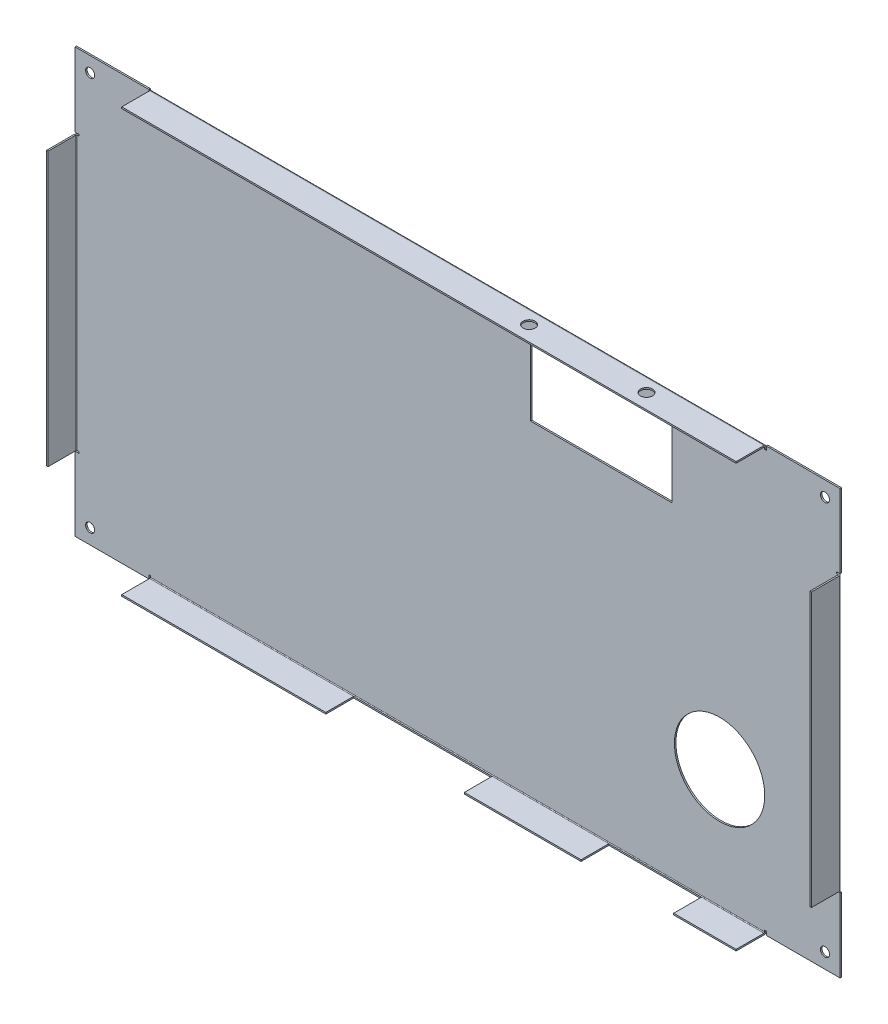
from build123d import *

# Parameters (mm, degrees)
SKETCH_1_W                        = 508
SKETCH_1_H                        = 281.5
SKETCH_1_R                        = 3
SKETCH_1_R_2                      = 30
SKETCH_1_W_2                      = 94
SKETCH_1_H_2                      = 46
SM_BASE_FLANGE_1_DEPTH            = 1
SM_EDGE_FLANGE_1_STRIP_W          = 5
SM_EDGE_FLANGE_1_STRIP_H          = 1
SM_EDGE_FLANGE_1_STRIP_CUT_DEPTH  = 408
SM_EDGE_FLANGE_1_RELIEF_W         = 6
SM_EDGE_FLANGE_1_RELIEF_H         = 1
SM_EDGE_FLANGE_1_RELIEF_CUT_DEPTH = 1
SM_EDGE_FLANGE_1_DEPTH            = 408
SM_EDGE_FLANGE_2_STRIP_W          = 5
SM_EDGE_FLANGE_2_STRIP_H          = 1
SM_EDGE_FLANGE_2_STRIP_CUT_DEPTH  = 408
SM_EDGE_FLANGE_2_RELIEF_W         = 6
SM_EDGE_FLANGE_2_RELIEF_H         = 1
SM_EDGE_FLANGE_2_RELIEF_CUT_DEPTH = 1
SM_EDGE_FLANGE_2_DEPTH            = 408
SM_EDGE_FLANGE_3_STRIP_W          = 5
SM_EDGE_FLANGE_3_STRIP_H          = 1
SM_EDGE_FLANGE_3_STRIP_CUT_DEPTH  = 181.5
SM_EDGE_FLANGE_3_RELIEF_W         = 6
SM_EDGE_FLANGE_3_RELIEF_H         = 1
SM_EDGE_FLANGE_3_RELIEF_CUT_DEPTH = 1
SM_EDGE_FLANGE_3_DEPTH            = 181.5
SM_EDGE_FLANGE_4_STRIP_W          = 5
SM_EDGE_FLANGE_4_STRIP_H          = 1
SM_EDGE_FLANGE_4_STRIP_CUT_DEPTH  = 181.5
SM_EDGE_FLANGE_4_RELIEF_W         = 6
SM_EDGE_FLANGE_4_RELIEF_H         = 1
SM_EDGE_FLANGE_4_RELIEF_CUT_DEPTH = 1
SM_EDGE_FLANGE_4_DEPTH            = 181.5
SKETCH_18_R                       = 4
CUT_EXTRUDE_1_DEPTH               = 379.889495764
SKETCH_19_W                       = 92
SKETCH_19_H                       = 18.5
SKETCH_19_W_2                     = 61.5
CUT_EXTRUDE_2_DEPTH               = 379.889495764


# Sheet-metal steps are written as plain solids
with BuildPart() as part:
    # Sketch 1 → 基体-法兰1 (new body)
    with BuildSketch(Plane.XY):
        Rectangle(SKETCH_1_W, SKETCH_1_H)
        with Locations((-244, 130.75)):
            Circle(SKETCH_1_R, mode=Mode.SUBTRACT)
        with Locations((-244, -130.75)):
            Circle(SKETCH_1_R, mode=Mode.SUBTRACT)
        with Locations((244, 130.75)):
            Circle(SKETCH_1_R, mode=Mode.SUBTRACT)
        with Locations((244, -130.75)):
            Circle(SKETCH_1_R, mode=Mode.SUBTRACT)
        with Locations((174, -60.75)):
            Circle(SKETCH_1_R_2, mode=Mode.SUBTRACT)
        with Locations((95.5, 99.75)):
            Rectangle(SKETCH_1_W_2, SKETCH_1_H_2, mode=Mode.SUBTRACT)
    extrude(amount=-SM_BASE_FLANGE_1_DEPTH)

    # 边线-法兰1 strip (across the edge) → 边线-法兰1 strip cut (cut)
    with BuildSketch(Plane(origin=(204, 140.75, 0), x_dir=(0, -1, 0), z_dir=(-1, 0, 0))):
        with Locations((-1, -0.5)):
            Rectangle(SM_EDGE_FLANGE_1_STRIP_W, SM_EDGE_FLANGE_1_STRIP_H)
    extrude(amount=SM_EDGE_FLANGE_1_STRIP_CUT_DEPTH, mode=Mode.SUBTRACT)

    # 边线-法兰1 relief (on the sheet) → 边线-法兰1 relief cut (cut)
    with BuildSketch(Plane(origin=(204, 139.25, 0), x_dir=(0, -1, 0), z_dir=(0, 0, 1))):
        with Locations((-2, 0.5)):
            Rectangle(SM_EDGE_FLANGE_1_RELIEF_W, SM_EDGE_FLANGE_1_RELIEF_H)
        with Locations((-2, -408.5)):
            Rectangle(SM_EDGE_FLANGE_1_RELIEF_W, SM_EDGE_FLANGE_1_RELIEF_H)
    extrude(amount=-SM_EDGE_FLANGE_1_RELIEF_CUT_DEPTH, mode=Mode.SUBTRACT)

    # 边线-法兰1 section (across the edge) → 边线-法兰1 (add)
    with BuildSketch(Plane(origin=(204, 140.75, 0), x_dir=(0, -1, 0), z_dir=(-1, 0, 0))):
        with BuildLine():
            Line((0, 0.5), (0, 19))
            Line((0, 19), (1, 19))
            Line((1, 19), (1, 0.5))
            ThreePointArc((1, 0.5), (1.146446609, 0.146446609), (1.5, 0))
            Line((1.5, 0), (1.5, -1))
            ThreePointArc((1.5, -1), (0.439339828, -0.560660172), (0, 0.5))
        make_face()
    extrude(amount=SM_EDGE_FLANGE_1_DEPTH)

    # 边线-法兰2 strip (across the edge) → 边线-法兰2 strip cut (cut)
    with BuildSketch(Plane(origin=(-204, -140.75, 0), x_dir=(0, 1, 0), z_dir=(1, 0, 0))):
        with Locations((-1, -0.5)):
            Rectangle(SM_EDGE_FLANGE_2_STRIP_W, SM_EDGE_FLANGE_2_STRIP_H)
    extrude(amount=SM_EDGE_FLANGE_2_STRIP_CUT_DEPTH, mode=Mode.SUBTRACT)

    # 边线-法兰2 relief (on the sheet) → 边线-法兰2 relief cut (cut)
    with BuildSketch(Plane(origin=(-204, -139.25, 0), x_dir=(0, 1, 0), z_dir=(0, 0, 1))):
        with Locations((-2, 0.5)):
            Rectangle(SM_EDGE_FLANGE_2_RELIEF_W, SM_EDGE_FLANGE_2_RELIEF_H)
        with Locations((-2, -408.5)):
            Rectangle(SM_EDGE_FLANGE_2_RELIEF_W, SM_EDGE_FLANGE_2_RELIEF_H)
    extrude(amount=-SM_EDGE_FLANGE_2_RELIEF_CUT_DEPTH, mode=Mode.SUBTRACT)

    # 边线-法兰2 section (across the edge) → 边线-法兰2 (add)
    with BuildSketch(Plane(origin=(-204, -140.75, 0), x_dir=(0, 1, 0), z_dir=(1, 0, 0))):
        with BuildLine():
            Line((0, 0.5), (0, 19))
            Line((0, 19), (1, 19))
            Line((1, 19), (1, 0.5))
            ThreePointArc((1, 0.5), (1.146446609, 0.146446609), (1.5, 0))
            Line((1.5, 0), (1.5, -1))
            ThreePointArc((1.5, -1), (0.439339828, -0.560660172), (0, 0.5))
        make_face()
    extrude(amount=SM_EDGE_FLANGE_2_DEPTH)

    # 边线-法兰3 strip (across the edge) → 边线-法兰3 strip cut (cut)
    with BuildSketch(Plane(origin=(254, -90.75, 0), x_dir=(-1, 0, 0), z_dir=(0, 1, 0))):
        with Locations((-1, -0.5)):
            Rectangle(SM_EDGE_FLANGE_3_STRIP_W, SM_EDGE_FLANGE_3_STRIP_H)
    extrude(amount=SM_EDGE_FLANGE_3_STRIP_CUT_DEPTH, mode=Mode.SUBTRACT)

    # 边线-法兰3 relief (on the sheet) → 边线-法兰3 relief cut (cut)
    with BuildSketch(Plane(origin=(252.5, -90.75, 0), x_dir=(-1, 0, 0), z_dir=(0, 0, 1))):
        with Locations((-2, 0.5)):
            Rectangle(SM_EDGE_FLANGE_3_RELIEF_W, SM_EDGE_FLANGE_3_RELIEF_H)
        with Locations((-2, -182)):
            Rectangle(SM_EDGE_FLANGE_3_RELIEF_W, SM_EDGE_FLANGE_3_RELIEF_H)
    extrude(amount=-SM_EDGE_FLANGE_3_RELIEF_CUT_DEPTH, mode=Mode.SUBTRACT)

    # 边线-法兰3 section (across the edge) → 边线-法兰3 (add)
    with BuildSketch(Plane(origin=(254, -90.75, 0), x_dir=(-1, 0, 0), z_dir=(0, 1, 0))):
        with BuildLine():
            Line((0, 0.5), (0, 19))
            Line((0, 19), (1, 19))
            Line((1, 19), (1, 0.5))
            ThreePointArc((1, 0.5), (1.146446609, 0.146446609), (1.5, 0))
            Line((1.5, 0), (1.5, -1))
            ThreePointArc((1.5, -1), (0.439339828, -0.560660172), (0, 0.5))
        make_face()
    extrude(amount=SM_EDGE_FLANGE_3_DEPTH)

    # 边线-法兰4 strip (across the edge) → 边线-法兰4 strip cut (cut)
    with BuildSketch(Plane(origin=(-254, 90.75, 0), x_dir=(1, 0, 0), z_dir=(0, -1, 0))):
        with Locations((-1, -0.5)):
            Rectangle(SM_EDGE_FLANGE_4_STRIP_W, SM_EDGE_FLANGE_4_STRIP_H)
    extrude(amount=SM_EDGE_FLANGE_4_STRIP_CUT_DEPTH, mode=Mode.SUBTRACT)

    # 边线-法兰4 relief (on the sheet) → 边线-法兰4 relief cut (cut)
    with BuildSketch(Plane(origin=(-252.5, 90.75, 0), x_dir=(1, 0, 0), z_dir=(0, 0, 1))):
        with Locations((-2, 0.5)):
            Rectangle(SM_EDGE_FLANGE_4_RELIEF_W, SM_EDGE_FLANGE_4_RELIEF_H)
        with Locations((-2, -182)):
            Rectangle(SM_EDGE_FLANGE_4_RELIEF_W, SM_EDGE_FLANGE_4_RELIEF_H)
    extrude(amount=-SM_EDGE_FLANGE_4_RELIEF_CUT_DEPTH, mode=Mode.SUBTRACT)

    # 边线-法兰4 section (across the edge) → 边线-法兰4 (add)
    with BuildSketch(Plane(origin=(-254, 90.75, 0), x_dir=(1, 0, 0), z_dir=(0, -1, 0))):
        with BuildLine():
            Line((0, 0.5), (0, 19))
            Line((0, 19), (1, 19))
            Line((1, 19), (1, 0.5))
            ThreePointArc((1, 0.5), (1.146446609, 0.146446609), (1.5, 0))
            Line((1.5, 0), (1.5, -1))
            ThreePointArc((1.5, -1), (0.439339828, -0.560660172), (0, 0.5))
        make_face()
    extrude(amount=SM_EDGE_FLANGE_4_DEPTH)

    # 草图18 → 切除-拉伸1 (cut, through all)
    with BuildSketch(Plane(origin=(0, 139.75, 0), x_dir=(-1, 0, 0), z_dir=(0, -1, 0))):
        with Locations(Location((-134.5, -9, 0), (0, 0, 90))):
            Circle(SKETCH_18_R)
        with Locations(Location((-56.5, -9, 0), (0, 0, 90))):
            Circle(SKETCH_18_R)
    extrude(amount=-CUT_EXTRUDE_1_DEPTH, mode=Mode.SUBTRACT)

    # 草图19 → 切除-拉伸2 (cut, through all)
    with BuildSketch(Plane(origin=(0, -139.75, 0), x_dir=(1, 0, 0), z_dir=(0, 1, 0))):
        with Locations((-22.5, -9.75)):
            Rectangle(SKETCH_19_W, SKETCH_19_H)
        with Locations((131.75, -9.75)):
            Rectangle(SKETCH_19_W_2, SKETCH_19_H)
    extrude(amount=-CUT_EXTRUDE_2_DEPTH, mode=Mode.SUBTRACT)


solid = part.part
